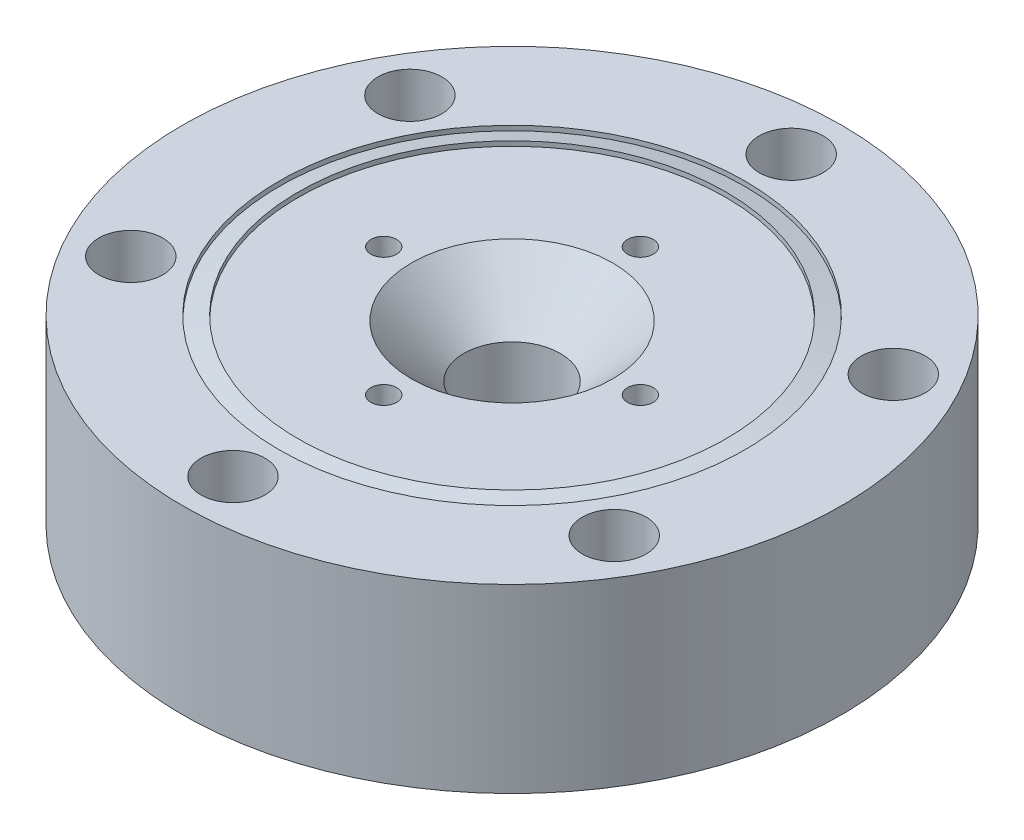
from build123d import *

# Parameters (mm, degrees)
SKETCH1_R           = 34.671
BOSS_EXTRUDE1_DEPTH = 19.05
SKETCH5_R           = 5.08
CUT_EXTRUDE1_DEPTH  = 53.602841957
CHAMFER1_SIZE       = 6
CIRPATTERN1_COUNT   = 4
SKETCH8_R           = 3.3655
CUT_EXTRUDE2_DEPTH  = 53.602841957
CIRPATTERN2_COUNT   = 6


with BuildPart() as part:
    # Sketch1 → Boss-Extrude1 (new body)
    with BuildSketch(Plane(origin=(0, 0, 0), x_dir=(1, 0, 0), z_dir=(0, 1, 0))):
        Circle(SKETCH1_R)
    extrude(amount=BOSS_EXTRUDE1_DEPTH)

    # Sketch5 → Cut-Extrude1 (cut, through all)
    with BuildSketch(Plane.XZ):
        Circle(SKETCH5_R)
    extrude(amount=-CUT_EXTRUDE1_DEPTH, mode=Mode.SUBTRACT)

    # Chamfer1
    chamfer1_edges = [part.edges().sort_by_distance(p)[0] for p in [
        (-5.08, 19.05, 0),
    ]]
    chamfer(chamfer1_edges, length=CHAMFER1_SIZE)

    # Sketch6 → #6-32 Tapped Hole1 (revolve, cut)
    with BuildSketch(Plane(origin=(0, 19.05, -13.5), x_dir=(0, 0, 1), z_dir=(1, 0, 0))):
        Polygon((0, 0), (0, 10.81269403), (1.35255, 10), (1.35255, 0), align=None)
    f_6_32_tapped_hole1 = revolve(axis=Axis((0, 25.4, -13.5), (0, -1, 0)), mode=Mode.SUBTRACT)

    # CirPattern1: #6-32 Tapped Hole1 ×4 about axis
    cirpattern1_axis = Axis((0, 19.05, 0), (0, -1, 0))
    for i in range(1, CIRPATTERN1_COUNT):
        add(f_6_32_tapped_hole1.rotate(cirpattern1_axis, i * 360 / CIRPATTERN1_COUNT), mode=Mode.SUBTRACT)

    # Sketch8 → Cut-Extrude2 (cut, through all)
    with BuildSketch(Plane(origin=(0, 19.05, 0), x_dir=(1, 0, 0), z_dir=(0, 1, 0))):
        with Locations((0, 29.3624)):
            Circle(SKETCH8_R)
    cut_extrude2 = extrude(amount=-CUT_EXTRUDE2_DEPTH, mode=Mode.SUBTRACT)

    # CirPattern2: Cut-Extrude2 ×6 about axis
    cirpattern2_axis = Axis((0, 19.05, 0), (0, -1, 0))
    for i in range(1, CIRPATTERN2_COUNT):
        add(cut_extrude2.rotate(cirpattern2_axis, i * 360 / CIRPATTERN2_COUNT), mode=Mode.SUBTRACT)

    # Sketch9 → Cut-Revolve1 (revolve, cut)
    with BuildSketch(Plane.XY):
        Polygon((0, -2.570803014), (0, 0.5), (22.5, 0.5), (22.5, 0), (24.5, 0.5), (24.5, -7.98797561), (0, -7.98797561), align=None)
    cut_revolve1 = revolve(axis=Axis((0, -2.570803014, 0), (0, 1, 0)), mode=Mode.SUBTRACT)

    # Mirror1: Cut-Revolve1 across plane
    add(cut_revolve1.mirror(Plane(origin=(0, 9.525, 0), x_dir=(0, 0, 1), z_dir=(0, -1, 0))), mode=Mode.SUBTRACT)


solid = part.part
